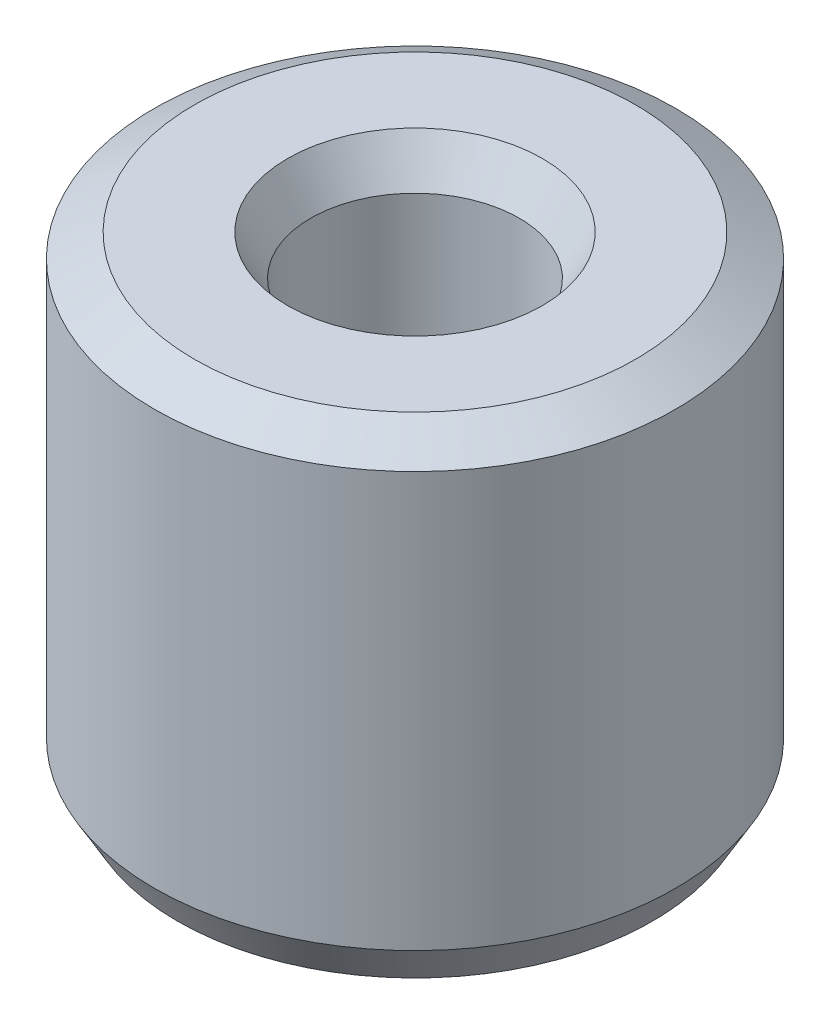
from build123d import *
from OCP.BRepFilletAPI import BRepFilletAPI_MakeChamfer

# Parameters (mm, degrees)
SKETCH1_R           = 32.5
BOSS_EXTRUDE1_DEPTH = 59.615822459
SKETCH2_R           = 13.004839775
CUT_EXTRUDE1_DEPTH  = 76.276465695
CHAMFER1_SIZE       = 2.886997283
CHAMFER1_SIZE2      = 5.000425976


with BuildPart() as part:
    # Sketch1 → Boss-Extrude1 (new body)
    with BuildSketch(Plane(origin=(0, 0, 0), x_dir=(1, 0, 0), z_dir=(0, 1, 0))):
        Circle(SKETCH1_R)
    extrude(amount=BOSS_EXTRUDE1_DEPTH)

    # Sketch2 → Cut-Extrude1 (cut, through all)
    with BuildSketch(Plane(origin=(0, 0, 0), x_dir=(1, 0, 0), z_dir=(0, 1, 0))):
        Circle(SKETCH2_R)
    extrude(amount=CUT_EXTRUDE1_DEPTH, mode=Mode.SUBTRACT)

    # Chamfer1: one chamfer whose edges measure the first distance from different faces: ONE call of the kernel's chamfer builder (chamfer() names one face for all edges)
    chamfer1_edges_1 = [part.edges().sort_by_distance(p)[0] for p in [
        (-13.004839775, 59.615822459, 0),
    ]]
    chamfer1_side_1 = [part.faces().sort_by_distance(p)[0] for p in [
        (-31.580761184, 59.615822459, 0),
    ]]
    chamfer1_edges_2 = [part.edges().sort_by_distance(p)[0] for p in [
        (-13.004839775, 0, 0),
    ]]
    chamfer1_side_2 = [part.faces().sort_by_distance(p)[0] for p in [
        (-13.004839775, 29.807911229, 0),
    ]]
    chamfer1_edges_3 = [part.edges().sort_by_distance(p)[0] for p in [
        (-32.5, 0, 0),
    ]]
    chamfer1_side_3 = [part.faces().sort_by_distance(p)[0] for p in [
        (-31.580761184, 0, 0),
    ]]
    chamfer1_edges_4 = [part.edges().sort_by_distance(p)[0] for p in [
        (-32.5, 59.615822459, 0),
    ]]
    chamfer1_side_4 = [part.faces().sort_by_distance(p)[0] for p in [
        (-32.5, 29.807911229, 0),
    ]]
    chamfer1 = BRepFilletAPI_MakeChamfer(part.part.solid().wrapped)
    for e in chamfer1_edges_1:
        chamfer1.Add(CHAMFER1_SIZE, CHAMFER1_SIZE2, e.wrapped, chamfer1_side_1[0].wrapped)  # the first distance lies on this face
    for e in chamfer1_edges_2:
        chamfer1.Add(CHAMFER1_SIZE, CHAMFER1_SIZE2, e.wrapped, chamfer1_side_2[0].wrapped)  # the first distance lies on this face
    for e in chamfer1_edges_3:
        chamfer1.Add(CHAMFER1_SIZE, CHAMFER1_SIZE2, e.wrapped, chamfer1_side_3[0].wrapped)  # the first distance lies on this face
    for e in chamfer1_edges_4:
        chamfer1.Add(CHAMFER1_SIZE, CHAMFER1_SIZE2, e.wrapped, chamfer1_side_4[0].wrapped)  # the first distance lies on this face
    add(Compound.cast(chamfer1.Shape()), mode=Mode.REPLACE)


solid = part.part
